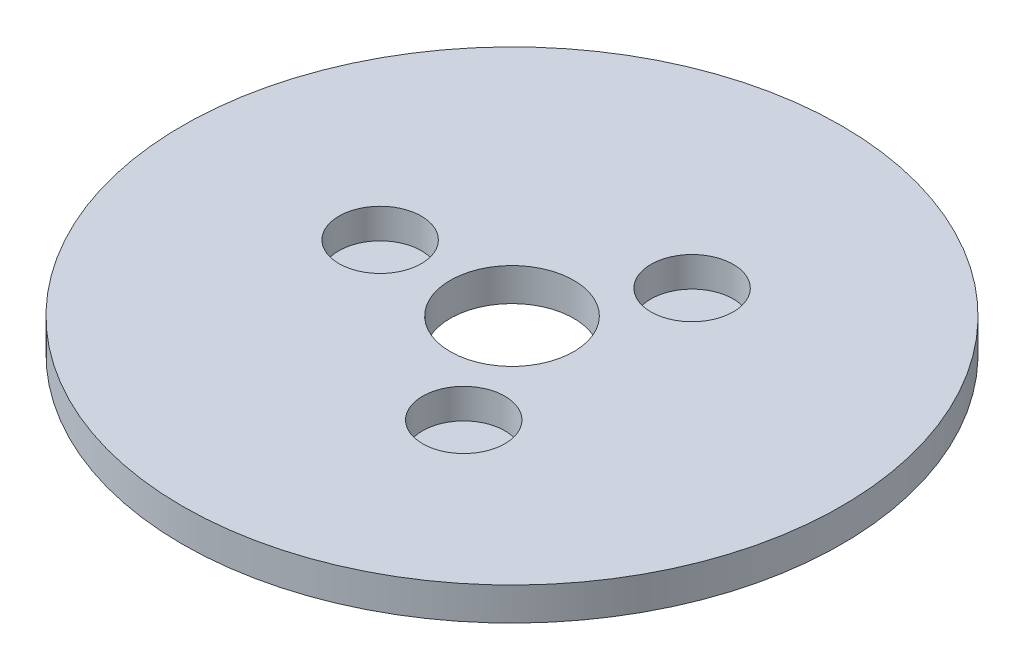
from build123d import *

# Parameters (mm, degrees)
SKETCH1_R           = 80
BOSS_EXTRUDE1_DEPTH = 8
SKETCH2_R           = 15
CUT_EXTRUDE1_DEPTH  = 114.41957503
SKETCH3_R           = 10
CUT_EXTRUDE2_DEPTH  = 7.275648392
CIRPATTERN1_COUNT   = 3


with BuildPart() as part:
    # Sketch1 → Boss-Extrude1 (new body)
    with BuildSketch(Plane(origin=(0, 0, 0), x_dir=(1, 0, 0), z_dir=(0, 1, 0))):
        Circle(SKETCH1_R)
    extrude(amount=BOSS_EXTRUDE1_DEPTH)

    # Sketch2 → Cut-Extrude1 (cut, through all)
    with BuildSketch(Plane(origin=(0, 0, 0), x_dir=(1, 0, 0), z_dir=(0, 1, 0))):
        Circle(SKETCH2_R)
    extrude(amount=CUT_EXTRUDE1_DEPTH, mode=Mode.SUBTRACT)

    # Sketch3 → Cut-Extrude2 (cut)
    with BuildSketch(Plane(origin=(0, 8, 0), x_dir=(1, 0, 0), z_dir=(0, 1, 0))):
        with Locations((-32.002176573, 0)):
            Circle(SKETCH3_R)
    cut_extrude2 = extrude(amount=-CUT_EXTRUDE2_DEPTH, mode=Mode.SUBTRACT)

    # CirPattern1: Cut-Extrude2 ×3 about axis
    cirpattern1_axis = Axis((0, 0, 0), (0, 1, 0))
    for i in range(1, CIRPATTERN1_COUNT):
        add(cut_extrude2.rotate(cirpattern1_axis, i * 360 / CIRPATTERN1_COUNT), mode=Mode.SUBTRACT)


solid = part.part
